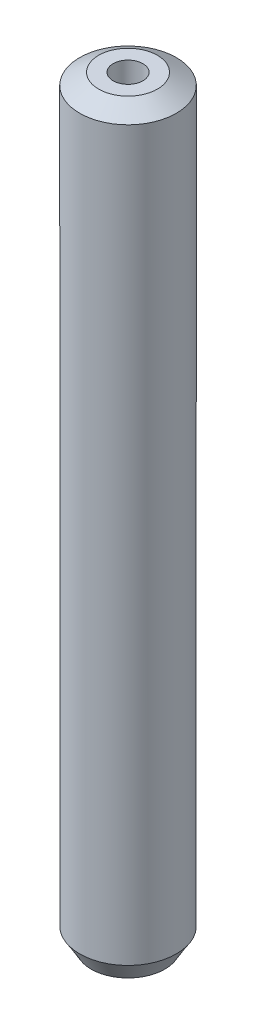
from build123d import *
from OCP.BRepFilletAPI import BRepFilletAPI_MakeChamfer

# Parameters (mm, degrees)
SKETCH1_R           = 10
BOSS_EXTRUDE1_DEPTH = 157.006909283
SKETCH2_R           = 3.082019904
CUT_EXTRUDE1_DEPTH  = 158.642537288
CHAMFER1_SIZE       = 2.363874016
CHAMFER1_SIZE2      = 3.925372378


with BuildPart() as part:
    # Sketch1 → Boss-Extrude1 (new body)
    with BuildSketch(Plane(origin=(0, 0, 0), x_dir=(1, 0, 0), z_dir=(0, 1, 0))):
        Circle(SKETCH1_R)
    extrude(amount=BOSS_EXTRUDE1_DEPTH)

    # Sketch2 → Cut-Extrude1 (cut, through all)
    with BuildSketch(Plane(origin=(0, 0, 0), x_dir=(1, 0, 0), z_dir=(0, 1, 0))):
        Circle(SKETCH2_R)
    extrude(amount=CUT_EXTRUDE1_DEPTH, mode=Mode.SUBTRACT)

    # Chamfer1: one chamfer whose edges measure the first distance from different faces: ONE call of the kernel's chamfer builder (chamfer() names one face for all edges)
    chamfer1_edges_1 = [part.edges().sort_by_distance(p)[0] for p in [
        (-10, 157.006909283, 0),
    ]]
    chamfer1_side_1 = [part.faces().sort_by_distance(p)[0] for p in [
        (-10, 78.503454641, 0),
    ]]
    chamfer1_edges_2 = [part.edges().sort_by_distance(p)[0] for p in [
        (-10, 0, 0),
    ]]
    chamfer1_side_2 = [part.faces().sort_by_distance(p)[0] for p in [
        (-9.717157288, 0, 0),
    ]]
    chamfer1 = BRepFilletAPI_MakeChamfer(part.part.solid().wrapped)
    for e in chamfer1_edges_1:
        chamfer1.Add(CHAMFER1_SIZE, CHAMFER1_SIZE2, e.wrapped, chamfer1_side_1[0].wrapped)  # the first distance lies on this face
    for e in chamfer1_edges_2:
        chamfer1.Add(CHAMFER1_SIZE, CHAMFER1_SIZE2, e.wrapped, chamfer1_side_2[0].wrapped)  # the first distance lies on this face
    add(Compound.cast(chamfer1.Shape()), mode=Mode.REPLACE)


solid = part.part
